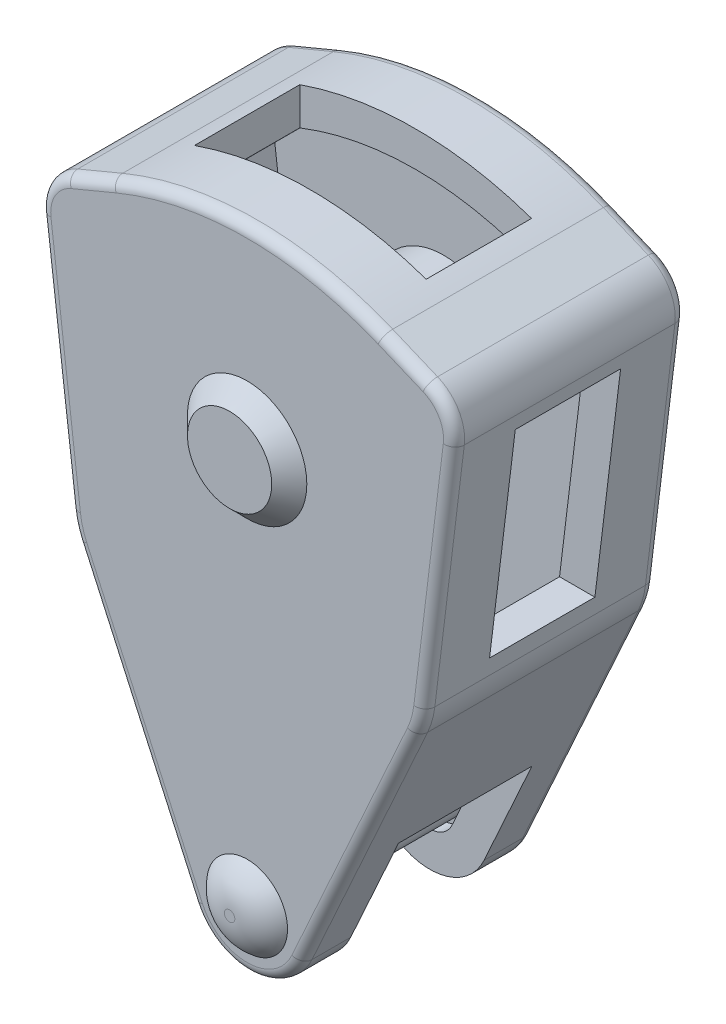
from build123d import *

# Parameters (mm, degrees)
BOSS_EXTRUDE1_DEPTH     = 8.382
FILLET1_R               = 25.4
FILLET2_R               = 3.175
FILLET3_R               = 6.35
SHELL1_T                = 2.54
CUT_EXTRUDE1_DEPTH      = 46.914035814
CUT_EXTRUDE1_DEPTH_BACK = 46.914035814
SKETCH2_W               = 9.652
SKETCH2_H               = 10.16
SKETCH3_R               = 1.397
BOSS_EXTRUDE2_DEPTH     = 16.764
SKETCH4_R               = 2.921
BOSS_EXTRUDE3_DEPTH     = 1.27
FILLET4_R               = 3.175
CUT_EXTRUDE2_DEPTH      = 47.162775769
CUT_EXTRUDE2_DEPTH_BACK = 47.162775769
SKETCH5_W               = 7.62
SKETCH5_H               = 15.24
SKETCH6_R               = 5.08
BOSS_EXTRUDE4_DEPTH     = 16.764
SKETCH7_R               = 4.318
BOSS_EXTRUDE5_DEPTH     = 1.27
CHAMFER1_SIZE           = 1.27
SKETCH9_W               = 16.764
SKETCH9_H               = 12.7
CUT_EXTRUDE3_DEPTH      = 3.81
FILLET5_R               = 0.762


# Some blends are built 0.0001 mm under size
with BuildPart() as part:
    # Sketch1 → Boss-Extrude1 (new, symmetric)
    with BuildSketch(Plane.XY):
        with BuildLine():
            Line((3.931691361, -1.785196639), (12.7, 17.526))
            Line((12.7, 17.526), (15.24, 38.354))
            Line((15.24, 38.354), (0, 44.704))
            Line((0, 44.704), (-15.24, 38.354))
            Line((-15.24, 38.354), (-12.7, 17.526))
            Line((-12.7, 17.526), (-3.931691361, -1.785196639))
            ThreePointArc((-3.931691361, -1.785196639), (0, -4.318), (3.931691361, -1.785196639))
        make_face()
    extrude(amount=BOSS_EXTRUDE1_DEPTH, both=True)

    # Fillet1
    fillet1_edges = [part.edges().sort_by_distance(p)[0] for p in [
        (0, 44.704, 0),
    ]]
    fillet(fillet1_edges, radius=FILLET1_R)

    # Fillet2
    fillet2_edges = [part.edges().sort_by_distance(p)[0] for p in [
        (-15.24, 38.354, 0),
        (15.24, 38.354, 0),
    ]]
    fillet(fillet2_edges, radius=FILLET2_R)

    # Fillet3
    fillet3_edges = [part.edges().sort_by_distance(p)[0] for p in [
        (-12.7, 17.526, 0),
        (12.7, 17.526, 0),
    ]]
    fillet(fillet3_edges, radius=FILLET3_R)

    # Shell1 (no face opened: a closed hollow body)
    add(offset(amount=-SHELL1_T, mode=Mode.PRIVATE), mode=Mode.SUBTRACT)

    # Sketch2 → Cut-Extrude1 (cut, two sides: drawn at the far end of the back side and taken through both)
    with BuildSketch(Plane(origin=(0, 0, 0), x_dir=(0, 0, -1), z_dir=(1, 0, 0)).offset(-CUT_EXTRUDE1_DEPTH_BACK)):
        with Locations((0, 0.762)):
            Rectangle(SKETCH2_W, SKETCH2_H)
    extrude(amount=CUT_EXTRUDE1_DEPTH + CUT_EXTRUDE1_DEPTH_BACK, mode=Mode.SUBTRACT)

    # Sketch3 → Boss-Extrude2 (add)
    with BuildSketch(Plane.XY.offset(8.382)):
        Circle(SKETCH3_R)
    extrude(amount=-BOSS_EXTRUDE2_DEPTH)

    # Sketch4 → Boss-Extrude3 (add)
    with BuildSketch(Plane.XY.offset(8.382)):
        Circle(SKETCH4_R)
    boss_extrude3 = extrude(amount=BOSS_EXTRUDE3_DEPTH)

    # Mirror1: Boss-Extrude3 across plane
    add(boss_extrude3.mirror(Plane.XY))

    # Fillet4
    # the kernel refuses this fillet: 3.175 mm, written as the material it takes off along each edge
    with BuildSketch(Plane(origin=(0, 0, 9.652), x_dir=(1, 0, 0), z_dir=(0, -1, 0))) as fillet4_piece_1:
        with BuildLine():
            CenterArc((0.381, -3.175), FILLET4_R, 36.869897646, 53.130102354)
            Line((0.381, 0), (0.381, 0.0635))
            Line((0.381, 0.0635), (2.921, 0.0635))
            Line((2.921, 0.0635), (2.9845, 0))
            ThreePointArc((2.9845, 0), (2.9845, -0.635), (2.9718, -1.2319))
            Line((2.9718, -1.2319), (2.921, -1.27))
        make_face()
    revolve(axis=Axis((0, 0, 9.652), (0, 0, 1)), mode=Mode.SUBTRACT)
    with BuildSketch(Plane(origin=(0, 0, -9.652), x_dir=(1, 0, 0), z_dir=(0, -1, 0))) as fillet4_piece_2:
        with BuildLine():
            CenterArc((0.381, 3.175), FILLET4_R, 270, 53.130102354)
            Line((0.381, 0), (0.381, -0.0635))
            Line((0.381, -0.0635), (2.921, -0.0635))
            Line((2.921, -0.0635), (2.9845, 0))
            ThreePointArc((2.9845, 0), (2.9845, 0.635), (2.9718, 1.2319))
            Line((2.9718, 1.2319), (2.921, 1.27))
        make_face()
    revolve(axis=Axis((0, 0, -9.652), (0, 0, 1)), mode=Mode.SUBTRACT)

    # Sketch5 → Cut-Extrude2 (cut, two sides: drawn at the far end of the back side and taken through both)
    with BuildSketch(Plane(origin=(0, 0, 0), x_dir=(0, 0, -1), z_dir=(1, 0, 0)).offset(-CUT_EXTRUDE2_DEPTH_BACK)):
        with Locations((0, 27.347333333)):
            Rectangle(SKETCH5_W, SKETCH5_H)
    extrude(amount=CUT_EXTRUDE2_DEPTH + CUT_EXTRUDE2_DEPTH_BACK, mode=Mode.SUBTRACT)

    # Sketch6 → Boss-Extrude4 (add)
    with BuildSketch(Plane.XY.offset(8.382)):
        with Locations((0, 28.575)):
            Circle(SKETCH6_R)
    extrude(amount=-BOSS_EXTRUDE4_DEPTH)

    # Sketch7 → Boss-Extrude5 (add)
    with BuildSketch(Plane.XY.offset(8.382)):
        with Locations((0, 28.575)):
            Circle(SKETCH7_R)
    boss_extrude5 = extrude(amount=BOSS_EXTRUDE5_DEPTH)

    # Mirror2: Boss-Extrude5 across plane
    add(boss_extrude5.mirror(Plane.XY))

    # Chamfer1
    chamfer1_edges = [part.edges().sort_by_distance(p)[0] for p in [
        (-4.318, 28.575, 9.652),
        (-4.318, 28.575, -9.652),
    ]]
    chamfer(chamfer1_edges, length=CHAMFER1_SIZE - 0.0001)  # a hair under: the kernel refuses the full size

    # Sketch9 → Cut-Extrude3 (cut, symmetric)
    with BuildSketch(Plane.XY):
        with Locations((0, 44.809833333)):
            Rectangle(SKETCH9_W, SKETCH9_H)
    extrude(amount=CUT_EXTRUDE3_DEPTH, both=True, mode=Mode.SUBTRACT)

    # Fillet5
    fillet5_edges = [part.edges().sort_by_distance(p)[0] for p in [
        (-11.393675882, 39.956635049, -8.382),
        (-11.393675882, 39.956635049, 8.382),
        (0, 42.587333333, -8.382),
        (0, 42.587333333, 8.382),
        (11.393675882, 39.956635049, -8.382),
        (11.393675882, 39.956635049, 8.382),
        (-13.88335447, 27.229506655, -8.382),
        (-14.540660788, 37.946752783, -8.382),
        (14.540660788, 37.946752783, -8.382),
        (-13.88335447, 27.229506655, 8.382),
        (-14.540660788, 37.946752783, 8.382),
        (14.540660788, 37.946752783, 8.382),
        (0, -4.318, 8.382),
        (13.88335447, 27.229506655, -8.382),
        (13.88335447, 27.229506655, 8.382),
        (-8.114190115, 7.426278367, -8.382),
        (-12.628279179, 17.546141938, -8.382),
        (12.628279179, 17.546141938, -8.382),
        (-8.114190115, 7.426278367, 8.382),
        (-12.628279179, 17.546141938, 8.382),
        (12.628279179, 17.546141938, 8.382),
        (8.114190115, 7.426278367, 8.382),
        (8.114190115, 7.426278367, -8.382),
        (0, -4.318, -8.382),
    ]]
    fillet(fillet5_edges, radius=FILLET5_R)


solid = part.part
